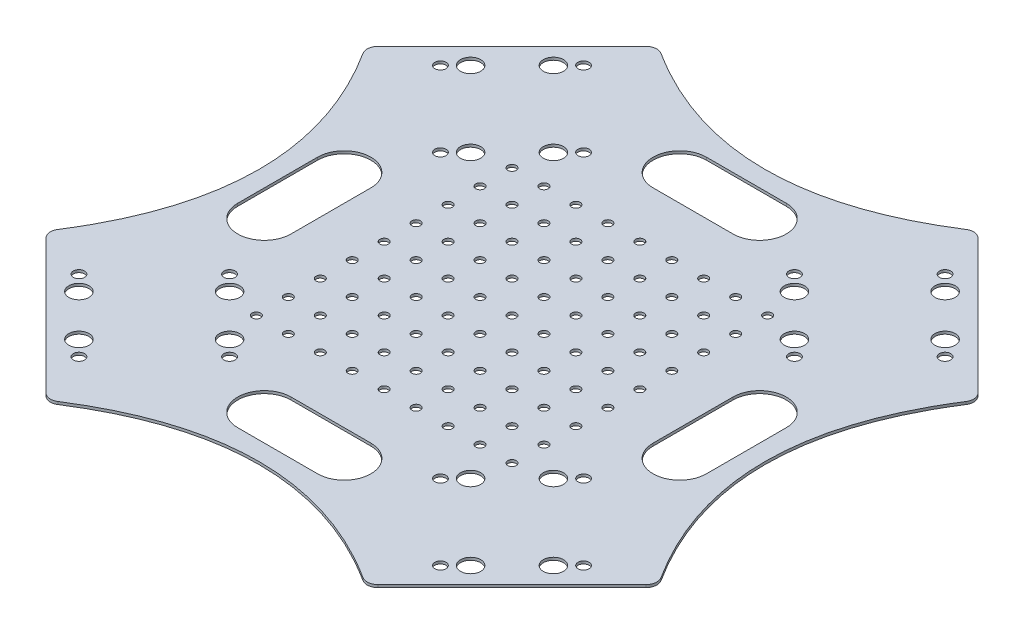
from build123d import *

# Parameters (mm, degrees)
DODANIE_WYCI_GNI_CIE1_DEPTH = 1
ZAOKR_GLENIE1_R             = 4
SZKIC2_R                    = 2.1
SZKIC2_R_2                  = 3.8
WYTNIJ_WYCI_GNI_CIE1_DEPTH  = 162.050129512
SZYK_KO_OWY1_COUNT          = 4
WYTNIJ_WYCI_GNI_CIE2_REACH  = 163.05
SZYK_KO_OWY2_COUNT          = 4
WYTNIJ_WYCI_GNI_CIE3_REACH  = 163.05
SZKIC4_R                    = 1.6
SZYK_LINIOWY1_COUNT         = 5
SZYK_LINIOWY1_PITCH         = 12
SZYK_LINIOWY1_COUNT_DIR2    = 5
SZYK_LINIOWY1_PITCH_DIR2    = 12
SZYK_KO_OWY3_OUTLINE_R      = 1.6
SZYK_KO_OWY3_DEPTH          = 1


# Read off the part's stored shape, not the designer's step: Szyk kołowy3
with BuildPart() as part:
    # Szkic1 → Dodanie-wyciągnięcie1 (new body)
    with BuildSketch(Plane(origin=(0, 0, 0), x_dir=(1, 0, 0), z_dir=(0, 1, 0))):
        with BuildLine():
            Line((-60, -115), (-115, -60))
            add(Edge.make_bspline(
                [(-115, 60), (-75, 0), (-115, -60)],
                knots=[0, 0, 0, 1, 1, 1], degree=2))
            Line((-115, 60), (-60, 115))
            add(Edge.make_bspline(
                [(60, 115), (0, 75), (-60, 115)],
                knots=[0, 0, 0, 1, 1, 1], degree=2))
            Line((60, 115), (115, 60))
            add(Edge.make_bspline(
                [(115, -60), (75, 0), (115, 60)],
                knots=[0, 0, 0, 1, 1, 1], degree=2))
            Line((115, -60), (60, -115))
            add(Edge.make_bspline(
                [(-60, -115), (0, -75), (60, -115)],
                knots=[0, 0, 0, 1, 1, 1], degree=2))
        make_face()
    extrude(amount=DODANIE_WYCI_GNI_CIE1_DEPTH)

    # Zaokrąglenie1
    zaokr_glenie1_edges = [part.edges().sort_by_distance(p)[0] for p in [
        (-115, 0.5, -60),
        (-60, 0.5, -115),
        (60, 0.5, -115),
        (115, 0.5, -60),
        (115, 0.5, 60),
        (60, 0.5, 115),
        (-115, 0.5, 60),
        (-60, 0.5, 115),
    ]]
    fillet(zaokr_glenie1_edges, radius=ZAOKR_GLENIE1_R)

    # Szkic2 → Wytnij-wyciągnięcie1 (cut, through all)
    with BuildSketch(Plane(origin=(0, 1, 0), x_dir=(1, 0, 0), z_dir=(0, 1, 0))):
        with Locations(Location((-67.882250994, -94.752308679, 0), (0, 0, 270))):
            Circle(SZKIC2_R)
        with Locations(Location((-94.752308679, -67.882250994, 0), (0, 0, 90))):
            Circle(SZKIC2_R)
        with Locations(Location((-39.597979746, -66.468037432, 0), (0, 0, 90))):
            Circle(SZKIC2_R)
        with Locations(Location((-66.468037432, -39.597979746, 0), (0, 0, 270))):
            Circle(SZKIC2_R)
        with Locations(Location((-73.539105243, -89.09545443, 0), (0, 0, 270))):
            Circle(SZKIC2_R_2)
        with Locations(Location((-89.09545443, -73.539105243, 0), (0, 0, 90))):
            Circle(SZKIC2_R_2)
        with Locations(Location((-60.811183182, -45.254833996, 0), (0, 0, 270))):
            Circle(SZKIC2_R_2)
        with Locations(Location((-45.254833996, -60.811183182, 0), (0, 0, 90))):
            Circle(SZKIC2_R_2)
    wytnij_wyci_gni_cie1 = extrude(amount=-WYTNIJ_WYCI_GNI_CIE1_DEPTH, mode=Mode.SUBTRACT)

    # Szyk kołowy1: Wytnij-wyciągnięcie1 ×4 about axis
    szyk_ko_owy1_axis = Axis((0, 0, 0), (0, 1, 0))
    for i in range(1, SZYK_KO_OWY1_COUNT):
        add(wytnij_wyci_gni_cie1.rotate(szyk_ko_owy1_axis, i * 360 / SZYK_KO_OWY1_COUNT), mode=Mode.SUBTRACT)

    # Szkic3 → Wytnij-wyciągnięcie2 (cut, up to next)
    with BuildSketch(Plane(origin=(0, 1, 0), x_dir=(1, 0, 0), z_dir=(0, 1, 0)), mode=Mode.PRIVATE) as wytnij_wyci_gni_cie2_sk1:
        with BuildLine():
            Line((-15, 88), (15, 88))
            ThreePointArc((15, 88), (25, 78), (15, 68))
            Line((15, 68), (-15, 68))
            ThreePointArc((-15, 68), (-25, 78), (-15, 88))
        make_face()
    wytnij_wyci_gni_cie2_tool1 = extrude(wytnij_wyci_gni_cie2_sk1.sketch, amount=-WYTNIJ_WYCI_GNI_CIE2_REACH, mode=Mode.PRIVATE) & part.part
    wytnij_wyci_gni_cie2 = wytnij_wyci_gni_cie2_tool1.solids().sort_by_distance((0, 1, -78))[0]
    add(wytnij_wyci_gni_cie2, mode=Mode.SUBTRACT)

    # Szyk kołowy2: Wytnij-wyciągnięcie2 ×4 about axis
    szyk_ko_owy2_axis = Axis((0, 0, 0), (0, 1, 0))
    for i in range(1, SZYK_KO_OWY2_COUNT):
        add(wytnij_wyci_gni_cie2.rotate(szyk_ko_owy2_axis, i * 360 / SZYK_KO_OWY2_COUNT), mode=Mode.SUBTRACT)

    # Szkic4 → Wytnij-wyciągnięcie3 (cut, up to next)
    with BuildSketch(Plane(origin=(0, 1, 0), x_dir=(1, 0, 0), z_dir=(0, 1, 0)), mode=Mode.PRIVATE) as wytnij_wyci_gni_cie3_sk1:
        with Locations(Location((0, 0, 0), (0, 0, 270))):
            Circle(SZKIC4_R)
    wytnij_wyci_gni_cie3_tool1 = extrude(wytnij_wyci_gni_cie3_sk1.sketch, amount=-WYTNIJ_WYCI_GNI_CIE3_REACH, mode=Mode.PRIVATE) & part.part
    wytnij_wyci_gni_cie3 = wytnij_wyci_gni_cie3_tool1.solids().sort_by_distance((0, 1, 0))[0]
    add(wytnij_wyci_gni_cie3, mode=Mode.SUBTRACT)

    # Szyk liniowy1: Wytnij-wyci_gni_cie3 5 × 5
    with Locations(*[(i * SZYK_LINIOWY1_PITCH, 0, j * SZYK_LINIOWY1_PITCH_DIR2) for i in range(SZYK_LINIOWY1_COUNT) for j in range(SZYK_LINIOWY1_COUNT_DIR2) if (i, j) != (0, 0)]):
        add(wytnij_wyci_gni_cie3, mode=Mode.SUBTRACT)

    # Szyk kołowy3 outline → Szyk kołowy3 (cut)
    with BuildSketch(Plane(origin=(0, 0, 0), x_dir=(1, 0, 0), z_dir=(0, 1, 0))):
        with Locations((0, 48)):
            Circle(SZYK_KO_OWY3_OUTLINE_R)
        with Locations((48, 36)):
            Circle(SZYK_KO_OWY3_OUTLINE_R)
        with Locations((36, 36)):
            Circle(SZYK_KO_OWY3_OUTLINE_R)
        with Locations((24, 36)):
            Circle(SZYK_KO_OWY3_OUTLINE_R)
        with Locations((12, 48)):
            Circle(SZYK_KO_OWY3_OUTLINE_R)
        with Locations((24, 48)):
            Circle(SZYK_KO_OWY3_OUTLINE_R)
        with Locations((36, 48)):
            Circle(SZYK_KO_OWY3_OUTLINE_R)
        with Locations((48, 48)):
            Circle(SZYK_KO_OWY3_OUTLINE_R)
        with Locations((0, 12)):
            Circle(SZYK_KO_OWY3_OUTLINE_R)
        with Locations((12, 12)):
            Circle(SZYK_KO_OWY3_OUTLINE_R)
        with Locations((24, 12)):
            Circle(SZYK_KO_OWY3_OUTLINE_R)
        with Locations((36, 12)):
            Circle(SZYK_KO_OWY3_OUTLINE_R)
        with Locations((12, 36)):
            Circle(SZYK_KO_OWY3_OUTLINE_R)
        with Locations((0, 36)):
            Circle(SZYK_KO_OWY3_OUTLINE_R)
        with Locations((48, 24)):
            Circle(SZYK_KO_OWY3_OUTLINE_R)
        with Locations((36, 24)):
            Circle(SZYK_KO_OWY3_OUTLINE_R)
        with Locations((48, 12)):
            Circle(SZYK_KO_OWY3_OUTLINE_R)
        with Locations((0, 24)):
            Circle(SZYK_KO_OWY3_OUTLINE_R)
        with Locations((12, 24)):
            Circle(SZYK_KO_OWY3_OUTLINE_R)
        with Locations((24, 24)):
            Circle(SZYK_KO_OWY3_OUTLINE_R)
        with Locations((-48, 0)):
            Circle(SZYK_KO_OWY3_OUTLINE_R)
        with Locations((-36, 48)):
            Circle(SZYK_KO_OWY3_OUTLINE_R)
        with Locations((-36, 36)):
            Circle(SZYK_KO_OWY3_OUTLINE_R)
        with Locations((-36, 24)):
            Circle(SZYK_KO_OWY3_OUTLINE_R)
        with Locations((-48, 12)):
            Circle(SZYK_KO_OWY3_OUTLINE_R)
        with Locations((-48, 24)):
            Circle(SZYK_KO_OWY3_OUTLINE_R)
        with Locations((-48, 36)):
            Circle(SZYK_KO_OWY3_OUTLINE_R)
        with Locations((-48, 48)):
            Circle(SZYK_KO_OWY3_OUTLINE_R)
        with Locations((-12, 0)):
            Circle(SZYK_KO_OWY3_OUTLINE_R)
        with Locations((-12, 12)):
            Circle(SZYK_KO_OWY3_OUTLINE_R)
        with Locations((-12, 24)):
            Circle(SZYK_KO_OWY3_OUTLINE_R)
        with Locations((-12, 36)):
            Circle(SZYK_KO_OWY3_OUTLINE_R)
        with Locations((-36, 12)):
            Circle(SZYK_KO_OWY3_OUTLINE_R)
        with Locations((-36, 0)):
            Circle(SZYK_KO_OWY3_OUTLINE_R)
        with Locations((-24, 48)):
            Circle(SZYK_KO_OWY3_OUTLINE_R)
        with Locations((-24, 36)):
            Circle(SZYK_KO_OWY3_OUTLINE_R)
        with Locations((-12, 48)):
            Circle(SZYK_KO_OWY3_OUTLINE_R)
        with Locations((-24, 0)):
            Circle(SZYK_KO_OWY3_OUTLINE_R)
        with Locations((-24, 12)):
            Circle(SZYK_KO_OWY3_OUTLINE_R)
        with Locations((-24, 24)):
            Circle(SZYK_KO_OWY3_OUTLINE_R)
        with Locations((-48, -36)):
            Circle(SZYK_KO_OWY3_OUTLINE_R)
        with Locations((-36, -36)):
            Circle(SZYK_KO_OWY3_OUTLINE_R)
        with Locations((-24, -36)):
            Circle(SZYK_KO_OWY3_OUTLINE_R)
        with Locations((-12, -48)):
            Circle(SZYK_KO_OWY3_OUTLINE_R)
        with Locations((-24, -48)):
            Circle(SZYK_KO_OWY3_OUTLINE_R)
        with Locations((-36, -48)):
            Circle(SZYK_KO_OWY3_OUTLINE_R)
        with Locations((-48, -48)):
            Circle(SZYK_KO_OWY3_OUTLINE_R)
        with Locations((-12, -12)):
            Circle(SZYK_KO_OWY3_OUTLINE_R)
        with Locations((-24, -12)):
            Circle(SZYK_KO_OWY3_OUTLINE_R)
        with Locations((-36, -12)):
            Circle(SZYK_KO_OWY3_OUTLINE_R)
        with Locations((-12, -36)):
            Circle(SZYK_KO_OWY3_OUTLINE_R)
        with Locations((-48, -24)):
            Circle(SZYK_KO_OWY3_OUTLINE_R)
        with Locations((-36, -24)):
            Circle(SZYK_KO_OWY3_OUTLINE_R)
        with Locations((-48, -12)):
            Circle(SZYK_KO_OWY3_OUTLINE_R)
        with Locations((-12, -24)):
            Circle(SZYK_KO_OWY3_OUTLINE_R)
        with Locations((-24, -24)):
            Circle(SZYK_KO_OWY3_OUTLINE_R)
    extrude(amount=SZYK_KO_OWY3_DEPTH, mode=Mode.SUBTRACT)


solid = part.part
